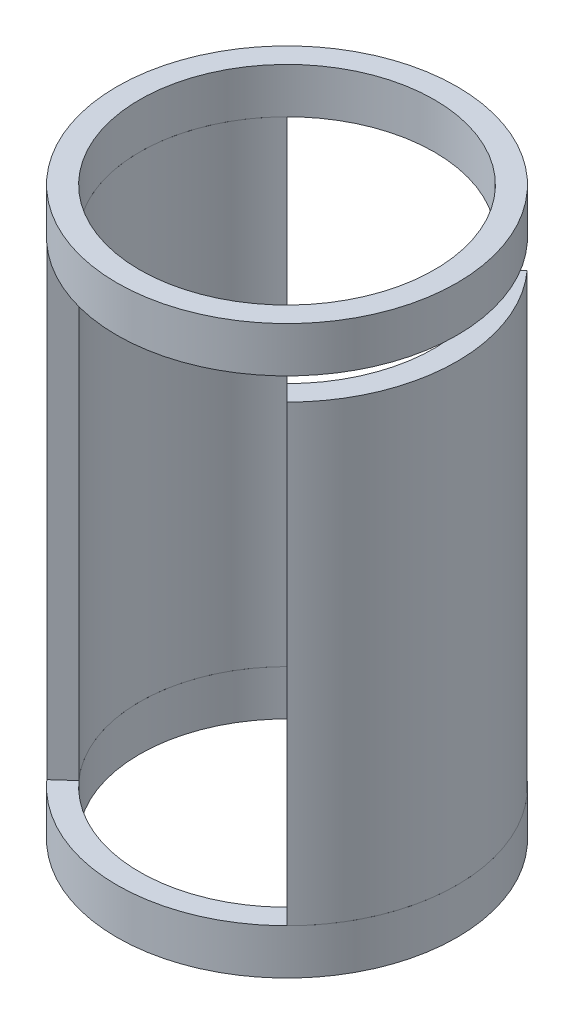
from build123d import *

# Parameters (mm, degrees)
EXTRUDE_THIN1_DEPTH     = 21
EXTRUDE_THIN1_2_DEPTH   = 21
SKETCH5_R               = 7.5
SKETCH5_R_2             = 6.5
EXTRUDE_THIN5_DEPTH     = 2
F_3DSKETCH3_R           = 7.5
F_3DSKETCH3_R_2         = 6.5
BOSS_EXTRUDE3_DEPTH     = 2
CUT_EXTRUDE1_DEPTH      = 26.327850284
CUT_EXTRUDE1_DEPTH_BACK = 1


with BuildPart() as part:
    # Sketch1 → Extrude-Thin1 (new body)
    with BuildSketch(Plane(origin=(0, 0, 0), x_dir=(1, 0, 0), z_dir=(0, 1, 0))):
        with BuildLine():
            ThreePointArc((-5.303300859, 5.303300859), (-7.497429937, 0.196327112), (-5.573586191, -5.018479548))
            Line((-5.573586191, -5.018479548), (-4.830441366, -4.349348941))
            ThreePointArc((-4.830441366, -4.349348941), (-6.497772612, 0.170150164), (-4.596194078, 4.596194078))
            Line((-4.596194078, 4.596194078), (-5.303300859, 5.303300859))
        make_face()
    extrude(amount=EXTRUDE_THIN1_DEPTH)


with BuildPart() as body_2:
    # Sketch1 → Extrude-Thin1 2 (new body)
    with BuildSketch(Plane(origin=(0, 0, 0), x_dir=(1, 0, 0), z_dir=(0, 1, 0))):
        with BuildLine():
            ThreePointArc((5.303300859, -5.303300859), (7.497429937, -0.196327112), (5.573586191, 5.018479548))
            Line((5.573586191, 5.018479548), (4.830441366, 4.349348941))
            ThreePointArc((4.830441366, 4.349348941), (6.497772612, -0.170150164), (4.596194078, -4.596194078))
            Line((4.596194078, -4.596194078), (5.303300859, -5.303300859))
        make_face()
    extrude(amount=EXTRUDE_THIN1_2_DEPTH)

    # Sketch12 → Cut-Extrude1 (cut, two sides: drawn at the far end of the back side and taken through both)
    with BuildSketch(Plane(origin=(0, 21, 0), x_dir=(1, 0, 0), z_dir=(0, 1, 0)).offset(-CUT_EXTRUDE1_DEPTH_BACK)):
        with BuildLine():
            Line((-24.753966258, 37.206162292), (4.830441366, 4.349348941))
            ThreePointArc((4.830441366, 4.349348941), (6.497772612, -0.170150164), (4.596194078, -4.596194078))
            Line((4.596194078, -4.596194078), (-26.66726189, -35.859650045))
            Line((-26.66726189, -35.859650045), (61.72884346, -38.174383527))
            Line((61.72884346, -38.174383527), (63.642139092, 34.891428811))
            Line((63.642139092, 34.891428811), (-24.753966258, 37.206162292))
        make_face()
    extrude(amount=CUT_EXTRUDE1_DEPTH + CUT_EXTRUDE1_DEPTH_BACK, mode=Mode.SUBTRACT)


with BuildPart() as body_3:
    # Sketch5 → Extrude-Thin5 (new body)
    with BuildSketch(Plane(origin=(0, 0, 0), x_dir=(1, 0, 0), z_dir=(0, 1, 0))):
        Circle(SKETCH5_R)
        Circle(SKETCH5_R_2, mode=Mode.SUBTRACT)
    extrude(amount=-EXTRUDE_THIN5_DEPTH)


with BuildPart() as body_4:
    # 3DSketch3 → Boss-Extrude3 (new body)
    with BuildSketch(Plane.ZX.offset(21)):
        Circle(F_3DSKETCH3_R)
        Circle(F_3DSKETCH3_R_2, mode=Mode.SUBTRACT)
    extrude(amount=BOSS_EXTRUDE3_DEPTH)


solid = Compound([part.part, body_2.part, body_3.part, body_4.part])
